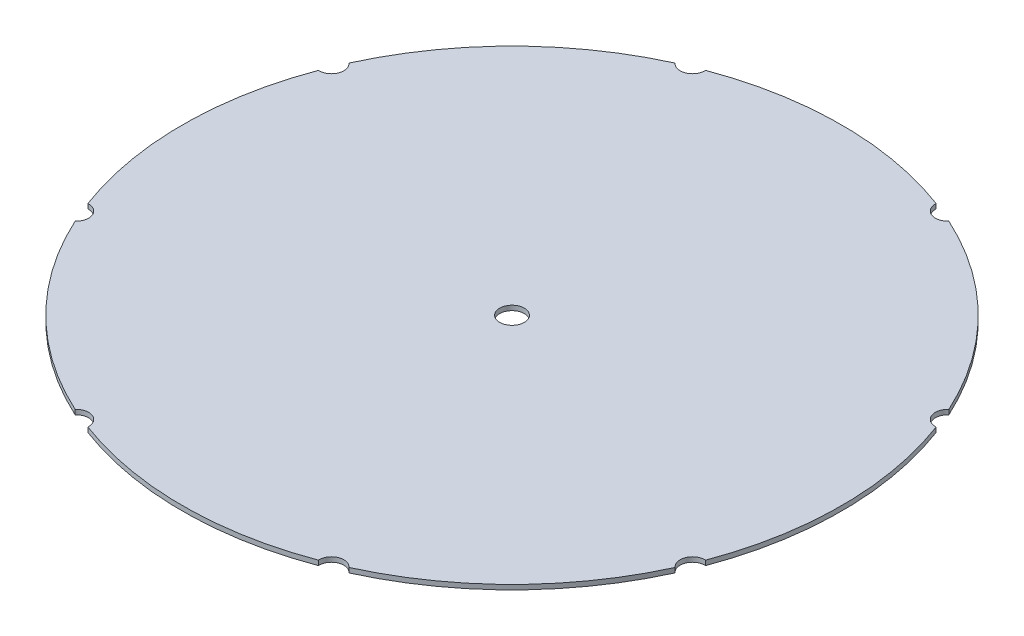
from build123d import *

# Parameters (mm, degrees)
SKETCH2_W                  = 69.2
SKETCH2_H                  = 1
F_6_0_204_DIAMETER_HOLE1_D = 5.1816
CIRPATTERN3_COUNT          = 8
F_6_0_204_DIAMETER_HOLE2_D = 5.1816


with BuildPart() as part:
    # Sketch2 → Revolve1 (revolve)
    with BuildSketch(Plane(origin=(0, 0, 0), x_dir=(0, 0, -1), z_dir=(1, 0, 0))):
        with Locations((-34.6, 0.5)):
            Rectangle(SKETCH2_W, SKETCH2_H)
    revolve(axis=Axis((0, -0.05, 0), (0, 1, 0)))

    # #6 (0.204) Diameter Hole1 (through all)
    with Locations(Plane(origin=(0, 1, 0), x_dir=(1, 0, 0), z_dir=(0, 1, 0))):
        with Locations((-26.787840266, 64.671567276)):
            f_6_0_204_diameter_hole1 = Hole(F_6_0_204_DIAMETER_HOLE1_D / 2)

    # CirPattern3: #6 (0.204) Diameter Hole1 ×8 about axis
    cirpattern3_axis = Axis((0, -0.05, 0), (0, 1, 0))
    for i in range(1, CIRPATTERN3_COUNT):
        add(f_6_0_204_diameter_hole1.rotate(cirpattern3_axis, i * 360 / CIRPATTERN3_COUNT), mode=Mode.SUBTRACT)

    # #6 (0.204) Diameter Hole2 (through all)
    with Locations(Plane(origin=(0, 1, 0), x_dir=(1, 0, 0), z_dir=(0, 1, 0))):
        with Locations((0, 0)):
            Hole(F_6_0_204_DIAMETER_HOLE2_D / 2)


solid = part.part
